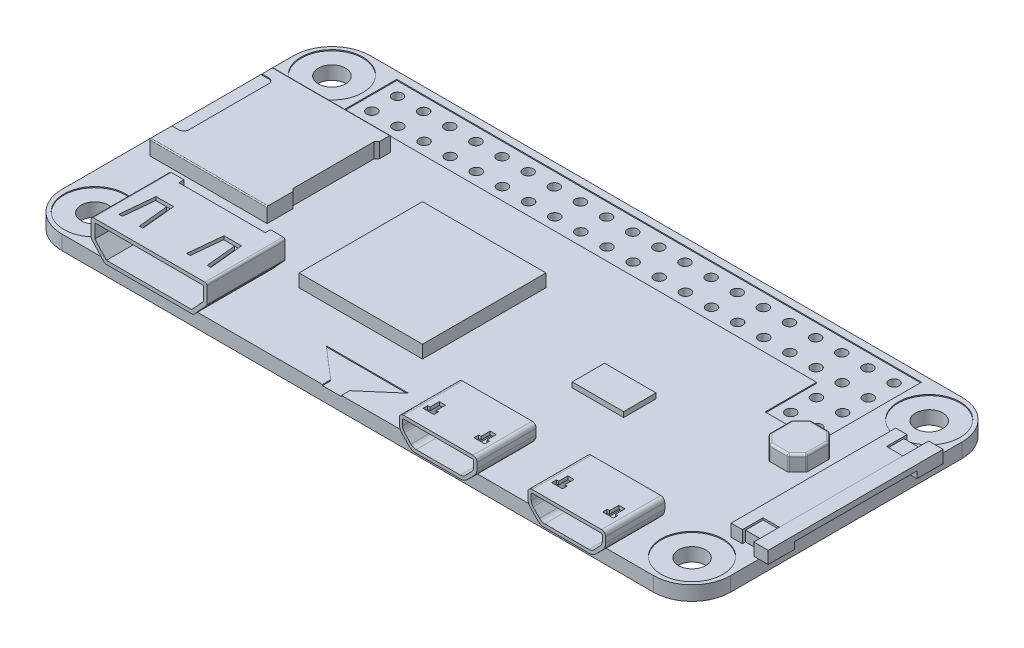
from build123d import *

# Parameters (mm, degrees)
BOSS_EXTRUDE1_DEPTH      = 1.4
SKETCH2_R                = 1.325
CUT_EXTRUDE1_DEPTH       = 36.821920663
SKETCH3_R                = 0.5
CUT_EXTRUDE2_DEPTH       = 36.821920663
LPATTERN1_COUNT          = 20
LPATTERN1_PITCH          = 2.54
SKETCH5_R                = 0.5
CUT_EXTRUDE4_DEPTH       = 36.821920663
SKETCH4_R                = 3
CUT_EXTRUDE3_DEPTH       = 0.1
SKETCH6_W                = 12
SKETCH6_H                = 12
BOSS_EXTRUDE2_DEPTH      = 1.25
BOSS_EXTRUDE3_DEPTH      = 1.45
FILLET2_R                = 0.1
CUT_EXTRUDE5_DEPTH       = 65.240816464
CUT_EXTRUDE5_DEPTH_BACK  = 9.5
SKETCH8_W                = 11.8
SKETCH8_H                = 1.25
BOSS_EXTRUDE4_DEPTH      = 0.4
BOSS_EXTRUDE4_DEPTH_BACK = 7.2
FILLET1_R                = 0.2
CUT_EXTRUDE6_DEPTH       = 7
SKETCH11_W               = 7
SKETCH11_H               = 0.55
BOSS_EXTRUDE5_DEPTH      = 3.5
CUT_EXTRUDE7_DEPTH       = 37.226130072
SKETCH13_W               = 8.4
SKETCH13_H               = 1.4
CUT_EXTRUDE8_DEPTH       = 0.5
BOSS_EXTRUDE6_DEPTH      = 1.25
BOSS_EXTRUDE6_DEPTH_BACK = 4.5
CUT_EXTRUDE9_DEPTH       = 5.25
SKETCH17_W               = 3.15
SKETCH17_H               = 0.4
BOSS_EXTRUDE7_DEPTH      = 3.5
CUT_EXTRUDE10_DEPTH      = 0.32
BOSS_EXTRUDE8_DEPTH      = 0.9
BOSS_EXTRUDE8_DEPTH_BACK = 0.5
BOSS_EXTRUDE9_DEPTH      = 1.19
SKETCH21_W               = 1.6
SKETCH21_H               = 1.7
BOSS_EXTRUDE10_DEPTH     = 1
SKETCH22_W               = 3.65
SKETCH22_H               = 4
BOSS_EXTRUDE11_DEPTH     = 1.5
CHAMFER1_SIZE            = 0.9
SKETCH23_W               = 5
SKETCH23_H               = 3.15
BOSS_EXTRUDE12_DEPTH     = 0.5
FILLET3_R                = 0.2
SKETCH_1_R               = 0.75
SKETCH_1_R_2             = 0.6
EXTRUDE_1_DEPTH          = 0.1


with BuildPart() as part:
    # Sketch1 → Boss-Extrude1 (new body)
    with BuildSketch(Plane(origin=(0, 0, 0), x_dir=(1, 0, 0), z_dir=(0, 1, 0))):
        with BuildLine():
            Line((-28.75, 15), (28.75, 15))
            ThreePointArc((28.75, 15), (31.401650429, 13.901650429), (32.5, 11.25))
            Line((32.5, 11.25), (32.5, -11.25))
            ThreePointArc((32.5, -11.25), (31.401650429, -13.901650429), (28.75, -15))
            Line((28.75, -15), (-28.75, -15))
            ThreePointArc((-28.75, -15), (-31.401650429, -13.901650429), (-32.5, -11.25))
            Line((-32.5, -11.25), (-32.5, 11.25))
            ThreePointArc((-32.5, 11.25), (-31.401650429, 13.901650429), (-28.75, 15))
        make_face()
    extrude(amount=BOSS_EXTRUDE1_DEPTH)

    # Sketch2 → Cut-Extrude1 (cut, through all)
    with BuildSketch(Plane(origin=(0, 1.4, 0), x_dir=(1, 0, 0), z_dir=(0, 1, 0))):
        with Locations(Location((-29.025, 11.525, 0), (0, 0, 270))):
            Circle(SKETCH2_R)
        with Locations(Location((29.025, 11.525, 0), (0, 0, 90))):
            Circle(SKETCH2_R)
        with Locations(Location((29.025, -11.525, 0), (0, 0, 270))):
            Circle(SKETCH2_R)
        with Locations(Location((-29.025, -11.525, 0), (0, 0, 90))):
            Circle(SKETCH2_R)
    extrude(amount=-CUT_EXTRUDE1_DEPTH, mode=Mode.SUBTRACT)

    # Sketch3 → Cut-Extrude2 (cut, through all)
    with BuildSketch(Plane(origin=(0, 1.4, 0), x_dir=(1, 0, 0), z_dir=(0, 1, 0))):
        with Locations(Location((-24.128, 13, 0), (0, 0, 270))):
            Circle(SKETCH3_R)
        with Locations(Location((-24.128, 10.5, 0), (0, 0, 270))):
            Circle(SKETCH3_R)
    cut_extrude2 = extrude(amount=-CUT_EXTRUDE2_DEPTH, mode=Mode.SUBTRACT)

    # LPattern1: Cut-Extrude2 ×20
    with Locations(*[(i * LPATTERN1_PITCH, 0, 0) for i in range(1, LPATTERN1_COUNT)]):
        add(cut_extrude2, mode=Mode.SUBTRACT)

    # Sketch5 → Cut-Extrude4 (cut, through all)
    with BuildSketch(Plane(origin=(0, 1.4, 0), x_dir=(1, 0, 0), z_dir=(0, 1, 0))):
        with Locations(Location((21.592, 5.5, 0), (0, 0, 270))):
            Circle(SKETCH5_R)
        with Locations(Location((24.132, 5.5, 0), (0, 0, 270))):
            Circle(SKETCH5_R)
        with Locations(Location((21.592, 8, 0), (0, 0, 270))):
            Circle(SKETCH5_R)
        with Locations(Location((24.132, 8, 0), (0, 0, 270))):
            Circle(SKETCH5_R)
    extrude(amount=-CUT_EXTRUDE4_DEPTH, mode=Mode.SUBTRACT)

    # Sketch4 → Cut-Extrude3 (cut)
    with BuildSketch(Plane(origin=(0, 1.4, 0), x_dir=(1, 0, 0), z_dir=(0, 1, 0))):
        with Locations(Location((-29.025, 11.525, 0), (0, 0, 270))):
            Circle(SKETCH4_R)
        with Locations(Location((-29.025, -11.525, 0), (0, 0, 270))):
            Circle(SKETCH4_R)
        with Locations(Location((29.025, -11.525, 0), (0, 0, 270))):
            Circle(SKETCH4_R)
        with Locations(Location((29.025, 11.525, 0), (0, 0, 270))):
            Circle(SKETCH4_R)
        Polygon((-25.5, 14.3), (25.5, 14.3), (25.5, 9.2), (25.5, 4.2), (20.4, 4.2), (20.4, 9.2), (-25.5, 9.2), align=None)
        Polygon((-6.5, -11.55), (1.5, -11.55), (-1.575, -14.2), (-1.575, -15), (-3.425, -15), (-3.425, -14.2), align=None)
    extrude(amount=-CUT_EXTRUDE3_DEPTH, mode=Mode.SUBTRACT)

    # Sketch6 → Boss-Extrude2 (add)
    with BuildSketch(Plane(origin=(0, 1.4, 0), x_dir=(1, 0, 0), z_dir=(0, 1, 0))):
        with Locations((-6.7, -2)):
            Rectangle(SKETCH6_W, SKETCH6_H)
    extrude(amount=BOSS_EXTRUDE2_DEPTH)

    # Sketch7 → Boss-Extrude3 (add)
    with BuildSketch(Plane(origin=(0, 1.4, 0), x_dir=(1, 0, 0), z_dir=(0, 1, 0))):
        with BuildLine():
            Line((-19.65, 7.85), (-19.65, 6.75))
            Line((-19.65, 6.75), (-19.9, 6.5))
            Line((-19.9, 6.5), (-19.9, -1.4))
            Line((-19.9, -1.4), (-19.65, -1.65))
            Line((-19.65, -1.65), (-19.65, -4.15))
            Line((-19.65, -4.15), (-31.05, -4.15))
            Line((-31.05, -4.15), (-31.05, -2))
            Line((-31.05, -2), (-30.4, -2))
            ThreePointArc((-30.4, -2), (-30.046446609, -1.853553391), (-29.9, -1.5))
            Line((-29.9, -1.5), (-29.9, 6.25))
            ThreePointArc((-29.9, 6.25), (-30.046446609, 6.603553391), (-30.4, 6.75))
            Line((-30.4, 6.75), (-31.05, 6.75))
            Line((-31.05, 6.75), (-31.05, 7.85))
            Line((-31.05, 7.85), (-19.65, 7.85))
        make_face()
    extrude(amount=BOSS_EXTRUDE3_DEPTH)

    # Fillet2
    fillet2_edges = [part.edges().sort_by_distance(p)[0] for p in [
        (-25.35, 2.85, 4.15),
        (-25.35, 2.85, -7.85),
    ]]
    fillet(fillet2_edges, radius=FILLET2_R)

    # Sketch8 → Cut-Extrude5 (cut, two sides: drawn at the far end of the back side and taken through both)
    with BuildSketch(Plane.ZY.offset(29.9).offset(-CUT_EXTRUDE5_DEPTH_BACK)):
        with Locations((-1.85, 2.125)):
            Rectangle(SKETCH8_W, SKETCH8_H)
    extrude(amount=CUT_EXTRUDE5_DEPTH + CUT_EXTRUDE5_DEPTH_BACK, mode=Mode.SUBTRACT)

    # Sketch15 → Boss-Extrude6 (add, two sides: drawn at the far end of the back side and taken through both)
    with BuildSketch(Plane.XY.offset(15).offset(-BOSS_EXTRUDE6_DEPTH_BACK)):
        with BuildLine():
            Line((18.2, 4), (24.95, 4))
            ThreePointArc((24.95, 4), (25.232842712, 3.882842712), (25.35, 3.6))
            Line((25.35, 3.6), (25.35, 3.052310288))
            ThreePointArc((25.35, 3.052310288), (25.277735771, 2.679072643), (25.071387321, 2.359778459))
            Line((25.071387321, 2.359778459), (24.445169445, 1.707468172))
            ThreePointArc((24.445169445, 1.707468172), (24.115871509, 1.480072876), (23.723782124, 1.4))
            Line((23.723782124, 1.4), (19.426217876, 1.4))
            ThreePointArc((19.426217876, 1.4), (19.034128491, 1.480072876), (18.704830555, 1.707468172))
            Line((18.704830555, 1.707468172), (18.078612679, 2.359778459))
            ThreePointArc((18.078612679, 2.359778459), (17.872264229, 2.679072643), (17.8, 3.052310288))
            Line((17.8, 3.052310288), (17.8, 3.6))
            ThreePointArc((17.8, 3.6), (17.917157288, 3.882842712), (18.2, 4))
        make_face()
        with BuildLine():
            Line((12.85, 3.6), (12.85, 3.052310288))
            ThreePointArc((12.85, 3.052310288), (12.777735771, 2.679072643), (12.571387321, 2.359778459))
            Line((12.571387321, 2.359778459), (11.945169445, 1.707468172))
            ThreePointArc((11.945169445, 1.707468172), (11.615871509, 1.480072876), (11.223782124, 1.4))
            Line((11.223782124, 1.4), (6.926217876, 1.4))
            ThreePointArc((6.926217876, 1.4), (6.534128491, 1.480072876), (6.204830555, 1.707468172))
            Line((6.204830555, 1.707468172), (5.578612679, 2.359778459))
            ThreePointArc((5.578612679, 2.359778459), (5.372264229, 2.679072643), (5.3, 3.052310288))
            Line((5.3, 3.052310288), (5.3, 3.6))
            ThreePointArc((5.3, 3.6), (5.417157288, 3.882842712), (5.7, 4))
            Line((5.7, 4), (12.45, 4))
            ThreePointArc((12.45, 4), (12.732842712, 3.882842712), (12.85, 3.6))
        make_face()
    extrude(amount=BOSS_EXTRUDE6_DEPTH + BOSS_EXTRUDE6_DEPTH_BACK)

    # Sketch16 → Cut-Extrude9 (cut)
    with BuildSketch(Plane.XY.offset(16.25)):
        with BuildLine():
            Line((12.45, 3.68), (5.7, 3.68))
            ThreePointArc((5.7, 3.68), (5.643431458, 3.656568542), (5.62, 3.6))
            Line((5.62, 3.6), (5.62, 3.052310288))
            ThreePointArc((5.62, 3.052310288), (5.669139676, 2.798508689), (5.809456622, 2.581388644))
            Line((5.809456622, 2.581388644), (6.435674498, 1.929078357))
            ThreePointArc((6.435674498, 1.929078357), (6.659597094, 1.774449555), (6.926217876, 1.72))
            Line((6.926217876, 1.72), (11.223782124, 1.72))
            ThreePointArc((11.223782124, 1.72), (11.490402906, 1.774449555), (11.714325502, 1.929078357))
            Line((11.714325502, 1.929078357), (12.340543378, 2.581388644))
            ThreePointArc((12.340543378, 2.581388644), (12.480860324, 2.798508689), (12.53, 3.052310288))
            Line((12.53, 3.052310288), (12.53, 3.6))
            ThreePointArc((12.53, 3.6), (12.506568542, 3.656568542), (12.45, 3.68))
        make_face()
        with BuildLine():
            Line((24.214325502, 1.929078357), (24.840543378, 2.581388644))
            ThreePointArc((24.840543378, 2.581388644), (24.980860324, 2.798508689), (25.03, 3.052310288))
            Line((25.03, 3.052310288), (25.03, 3.6))
            ThreePointArc((25.03, 3.6), (25.006568542, 3.656568542), (24.95, 3.68))
            Line((24.95, 3.68), (18.2, 3.68))
            ThreePointArc((18.2, 3.68), (18.143431458, 3.656568542), (18.12, 3.6))
            Line((18.12, 3.6), (18.12, 3.052310288))
            ThreePointArc((18.12, 3.052310288), (18.169139676, 2.798508689), (18.309456622, 2.581388644))
            Line((18.309456622, 2.581388644), (18.935674498, 1.929078357))
            ThreePointArc((18.935674498, 1.929078357), (19.159597094, 1.774449555), (19.426217876, 1.72))
            Line((19.426217876, 1.72), (23.723782124, 1.72))
            ThreePointArc((23.723782124, 1.72), (23.990402906, 1.774449555), (24.214325502, 1.929078357))
        make_face()
    extrude(amount=-CUT_EXTRUDE9_DEPTH, mode=Mode.SUBTRACT)

    # Sketch17 → Boss-Extrude7 (add)
    with BuildSketch(Plane.XY.offset(11)):
        with Locations((9.075, 3.12)):
            Rectangle(SKETCH17_W, SKETCH17_H)
        with Locations((21.575, 3.12)):
            Rectangle(SKETCH17_W, SKETCH17_H)
    extrude(amount=BOSS_EXTRUDE7_DEPTH)

    # Sketch18 → Cut-Extrude10 (cut)
    with BuildSketch(Plane(origin=(0, 4, 0), x_dir=(1, 0, 0), z_dir=(0, 1, 0))):
        Polygon((6.9, -13.37), (6.3, -13.37), (6.3, -14.27), (6.075, -14.27), (6.075, -14.72), (7.125, -14.72), (7.125, -14.27), (6.9, -14.27), align=None)
        Polygon((11.25, -13.37), (11.25, -14.27), (11.025, -14.27), (11.025, -14.72), (12.075, -14.72), (12.075, -14.27), (11.85, -14.27), (11.85, -13.37), align=None)
        Polygon((19.4, -13.37), (18.8, -13.37), (18.8, -14.27), (18.575, -14.27), (18.575, -14.72), (19.625, -14.72), (19.625, -14.27), (19.4, -14.27), align=None)
        Polygon((23.75, -13.37), (23.75, -14.27), (23.525, -14.27), (23.525, -14.72), (24.575, -14.72), (24.575, -14.27), (24.35, -14.27), (24.35, -13.37), align=None)
    extrude(amount=-CUT_EXTRUDE10_DEPTH, mode=Mode.SUBTRACT)

    # Sketch19 → Boss-Extrude8 (add, two sides: drawn at the far end of the back side and taken through both)
    with BuildSketch(Plane(origin=(32.5, 0, 0), x_dir=(0, 0, -1), z_dir=(1, 0, 0)).offset(-BOSS_EXTRUDE8_DEPTH_BACK)):
        Polygon((-8.5, 2.6), (8.5, 2.6), (8.5, 1.4), (5.95, 1.4), (5.95, 2.05), (-5.95, 2.05), (-5.95, 1.4), (-8.5, 1.4), align=None)
    extrude(amount=BOSS_EXTRUDE8_DEPTH + BOSS_EXTRUDE8_DEPTH_BACK)

    # Sketch20 → Boss-Extrude9 (add)
    with BuildSketch(Plane(origin=(0, 1.4, 0), x_dir=(1, 0, 0), z_dir=(0, 1, 0))):
        Polygon((32, 6), (30.4, 6), (30.4, 8), (29.3, 8), (29.3, -8), (30.4, -8), (30.4, -6), (32, -6), align=None)
    extrude(amount=BOSS_EXTRUDE9_DEPTH)

    # Sketch21 → Boss-Extrude10 (add)
    with BuildSketch(Plane(origin=(0, 1.4, 0), x_dir=(1, 0, 0), z_dir=(0, 1, 0))):
        with Locations((31.2, 6.85)):
            Rectangle(SKETCH21_W, SKETCH21_H)
        with Locations((31.2, -6.85)):
            Rectangle(SKETCH21_W, SKETCH21_H)
    extrude(amount=BOSS_EXTRUDE10_DEPTH)

    # Sketch22 → Boss-Extrude11 (add)
    with BuildSketch(Plane(origin=(0, 1.4, 0), x_dir=(1, 0, 0), z_dir=(0, 1, 0))):
        with Locations((25.675, 2.25)):
            Rectangle(SKETCH22_W, SKETCH22_H)
    extrude(amount=BOSS_EXTRUDE11_DEPTH)

    # Chamfer1
    # the kernel refuses this chamfer: 0.9 mm, written as the material it takes off along each edge
    with BuildSketch(Plane(origin=(23.85, 1.4, -4.25), x_dir=(0.9996219169112966, 0, -0.027495876610586487), z_dir=(0, 1, 0))) as chamfer1_piece_1:
        Polygon((CHAMFER1_SIZE * 0.999621916911, -CHAMFER1_SIZE * 0.0274958766106), (-CHAMFER1_SIZE * 0.0274958766106, -CHAMFER1_SIZE * 0.999621916911), (0, 0), align=None)
    extrude(amount=3.814514689, mode=Mode.SUBTRACT)
    with BuildSketch(Plane(origin=(23.85, 1.4, -0.25), x_dir=(0.9996219169112966, 0, 0.027495876610586487), z_dir=(0, 1, 0)), Plane(origin=(27.5, 1.4, -0.25), x_dir=(0.027495876610584467, 0, -0.9996219169112966), z_dir=(0, 1, 0)), Plane(origin=(27.5, 1.4, -4.25), x_dir=(-0.9996219169112966, 0, -0.027495876610586487), z_dir=(0, 1, 0))) as chamfer1_piece_2:
        Polygon((CHAMFER1_SIZE * 0.999621916911, CHAMFER1_SIZE * 0.0274958766106), (-CHAMFER1_SIZE * 0.0274958766106, CHAMFER1_SIZE * 0.999621916911), (0, 0), align=None)
    extrude(amount=3.814514689, mode=Mode.SUBTRACT)

    # Sketch23 → Boss-Extrude12 (add)
    with BuildSketch(Plane(origin=(0, 1.4, 0), x_dir=(1, 0, 0), z_dir=(0, 1, 0))):
        with Locations((11.5, -1.575)):
            Rectangle(SKETCH23_W, SKETCH23_H)
    extrude(amount=BOSS_EXTRUDE12_DEPTH)

    # Fillet3
    # the kernel refuses this fillet: 0.2 mm, written as the material it takes off along each edge
    with BuildSketch(Plane(origin=(24.05, 2.7, -1.232842712), x_dir=(-1, 0, 0), z_dir=(0, 1, 0))) as fillet3_piece_1_section:
        Polygon((0, 0), (FILLET3_R, 0), (FILLET3_R, FILLET3_R * 0.414213562373), (FILLET3_R * 0.707106781187, FILLET3_R * 0.707106781186), align=None)
    fillet3_piece_1 = extrude(amount=FILLET3_R, mode=Mode.PRIVATE)
    fillet3_piece_1 = fillet3_piece_1 - Plane(origin=(24.05, 2.7, -1.232842712), x_dir=(0.9238795325113632, 0, -0.38268343236490504), z_dir=(0, 1, 0)) * Sphere(FILLET3_R, mode=Mode.PRIVATE)
    add(fillet3_piece_1, mode=Mode.SUBTRACT)
    with BuildSketch(Plane(origin=(24.05, 2.7, -3.267157288), x_dir=(-0.7071067811868302, 0, -0.7071067811862648), z_dir=(0, 1, 0))) as fillet3_piece_2_section:
        Polygon((0, 0), (FILLET3_R, 0), (FILLET3_R, FILLET3_R * 0.414213562373), (FILLET3_R * 0.707106781187, FILLET3_R * 0.707106781186), align=None)
    fillet3_piece_2 = extrude(amount=FILLET3_R, mode=Mode.PRIVATE)
    fillet3_piece_2 = fillet3_piece_2 - Plane(origin=(24.05, 2.7, -3.267157288), x_dir=(0.9238795325113632, 0, 0.38268343236490504), z_dir=(0, 1, 0)) * Sphere(FILLET3_R, mode=Mode.PRIVATE)
    add(fillet3_piece_2, mode=Mode.SUBTRACT)
    with BuildSketch(Plane(origin=(24.832842712, 2.7, -4.05), x_dir=(0, 0, -1), z_dir=(0, 1, 0))) as fillet3_piece_3_section:
        Polygon((0, 0), (FILLET3_R, 0), (FILLET3_R, FILLET3_R * 0.414213562373), (FILLET3_R * 0.707106781186, FILLET3_R * 0.707106781187), align=None)
    fillet3_piece_3 = extrude(amount=FILLET3_R, mode=Mode.PRIVATE)
    fillet3_piece_3 = fillet3_piece_3 - Plane(origin=(24.832842712, 2.7, -4.05), x_dir=(0.38268343236527447, 0, 0.9238795325112102), z_dir=(0, 1, 0)) * Sphere(FILLET3_R, mode=Mode.PRIVATE)
    add(fillet3_piece_3, mode=Mode.SUBTRACT)
    with BuildSketch(Plane(origin=(26.517157288, 2.7, -4.05), x_dir=(0, 0, -1), z_dir=(0, 1, 0))) as fillet3_piece_4_section:
        Polygon((0, 0), (FILLET3_R, 0), (FILLET3_R, -FILLET3_R * 0.414213562373), (FILLET3_R * 0.707106781186, -FILLET3_R * 0.707106781187), align=None)
    fillet3_piece_4 = extrude(amount=FILLET3_R, mode=Mode.PRIVATE)
    fillet3_piece_4 = fillet3_piece_4 - Plane(origin=(26.517157288, 2.7, -4.05), x_dir=(-0.38268343236527447, 0, 0.9238795325112102), z_dir=(0, 1, 0)) * Sphere(FILLET3_R, mode=Mode.PRIVATE)
    add(fillet3_piece_4, mode=Mode.SUBTRACT)
    with BuildSketch(Plane(origin=(26.517157288, 2.7, -0.45), x_dir=(0, 0, 1), z_dir=(0, 1, 0))) as fillet3_piece_5_section:
        Polygon((0, 0), (FILLET3_R, 0), (FILLET3_R, FILLET3_R * 0.414213562373), (FILLET3_R * 0.707106781187, FILLET3_R * 0.707106781186), align=None)
    fillet3_piece_5 = extrude(amount=FILLET3_R, mode=Mode.PRIVATE)
    fillet3_piece_5 = fillet3_piece_5 - Plane(origin=(26.517157288, 2.7, -0.45), x_dir=(-0.3826834323649051, 0, -0.9238795325113633), z_dir=(0, 1, 0)) * Sphere(FILLET3_R, mode=Mode.PRIVATE)
    add(fillet3_piece_5, mode=Mode.SUBTRACT)
    with BuildSketch(Plane(origin=(24.832842712, 2.7, -0.45), x_dir=(0, 0, 1), z_dir=(0, 1, 0))) as fillet3_piece_6_section:
        Polygon((0, 0), (FILLET3_R, 0), (FILLET3_R, -FILLET3_R * 0.414213562373), (FILLET3_R * 0.707106781186, -FILLET3_R * 0.707106781187), align=None)
    fillet3_piece_6 = extrude(amount=FILLET3_R, mode=Mode.PRIVATE)
    fillet3_piece_6 = fillet3_piece_6 - Plane(origin=(24.832842712, 2.7, -0.45), x_dir=(0.38268343236527447, 0, -0.9238795325112102), z_dir=(0, 1, 0)) * Sphere(FILLET3_R, mode=Mode.PRIVATE)
    add(fillet3_piece_6, mode=Mode.SUBTRACT)
    with BuildSketch(Plane(origin=(27.3, 2.7, -3.267157288), x_dir=(0.7071067811868302, 0, -0.7071067811862648), z_dir=(0, 1, 0))) as fillet3_piece_7_section:
        Polygon((0, 0), (FILLET3_R, 0), (FILLET3_R, -FILLET3_R * 0.414213562373), (FILLET3_R * 0.707106781187, -FILLET3_R * 0.707106781186), align=None)
    fillet3_piece_7 = extrude(amount=FILLET3_R, mode=Mode.PRIVATE)
    fillet3_piece_7 = fillet3_piece_7 - Plane(origin=(27.3, 2.7, -3.267157288), x_dir=(-0.9238795325113632, 0, 0.38268343236490504), z_dir=(0, 1, 0)) * Sphere(FILLET3_R, mode=Mode.PRIVATE)
    add(fillet3_piece_7, mode=Mode.SUBTRACT)
    with BuildSketch(Plane(origin=(27.3, 2.7, -1.232842712), x_dir=(1, 0, 0), z_dir=(0, 1, 0))) as fillet3_piece_8_section:
        Polygon((0, 0), (FILLET3_R, 0), (FILLET3_R, -FILLET3_R * 0.414213562373), (FILLET3_R * 0.707106781186, -FILLET3_R * 0.707106781187), align=None)
    fillet3_piece_8 = extrude(amount=FILLET3_R, mode=Mode.PRIVATE)
    fillet3_piece_8 = fillet3_piece_8 - Plane(origin=(27.3, 2.7, -1.232842712), x_dir=(-0.9238795325112102, 0, -0.38268343236527447), z_dir=(0, 1, 0)) * Sphere(FILLET3_R, mode=Mode.PRIVATE)
    add(fillet3_piece_8, mode=Mode.SUBTRACT)
    with BuildSketch(Plane(origin=(23.85, 2.9, -1.232842712), x_dir=(0, -1, 0), z_dir=(0, 0, -1)), Plane(origin=(27.5, 2.9, -3.267157288), x_dir=(0, -1, 0), z_dir=(0, 0, 1))) as fillet3_piece_9:
        with BuildLine():
            CenterArc((FILLET3_R, -FILLET3_R), FILLET3_R, 90, 90)
            Line((0, -FILLET3_R), (0, 0))
            Line((0, 0), (FILLET3_R, 0))
        make_face()
    extrude(amount=2.034314575, mode=Mode.SUBTRACT)
    with BuildSketch(Plane(origin=(23.85, 1.4, -1.15), x_dir=(-4.331389821029687e-12, 0, -1.0), z_dir=(0, 1, 0)), Plane(origin=(23.85, 1.4, -3.35), x_dir=(0.7071067811862634, 0, -0.7071067811868317), z_dir=(0, 1, 0)), Plane(origin=(24.75, 1.4, -4.25), x_dir=(1.0, 0, 4.299226035225122e-12), z_dir=(0, 1, 0))) as fillet3_piece_10:
        with BuildLine():
            CenterArc((FILLET3_R * 0.414213562369, -FILLET3_R), FILLET3_R, 90, 45)
            Line((-FILLET3_R * 0.292893218816, -FILLET3_R * 0.292893218811), (0, 0))
            Line((0, 0), (FILLET3_R * 0.414213562373, 0))
        make_face()
    extrude(amount=1.3, mode=Mode.SUBTRACT)
    with BuildSketch(Plane(origin=(24.832842712, 2.9, -4.25), x_dir=(0, -1, 0), z_dir=(1, 0, 0)), Plane(origin=(26.517157288, 2.9, -0.25), x_dir=(0, -1, 0), z_dir=(-1, 0, 0))) as fillet3_piece_11:
        with BuildLine():
            CenterArc((FILLET3_R, -FILLET3_R), FILLET3_R, 90, 90)
            Line((0, -FILLET3_R), (0, 0))
            Line((0, 0), (FILLET3_R, 0))
        make_face()
    extrude(amount=1.684314575, mode=Mode.SUBTRACT)
    with BuildSketch(Plane(origin=(26.6, 1.4, -4.25), x_dir=(-1.0, 0, 4.299226035225122e-12), z_dir=(0, 1, 0)), Plane(origin=(27.5, 1.4, -1.15), x_dir=(-4.331389821024788e-12, 0, -1.0), z_dir=(0, 1, 0)), Plane(origin=(27.5, 1.4, -3.35), x_dir=(-0.7071067811862634, 0, -0.7071067811868317), z_dir=(0, 1, 0)), Plane(origin=(24.75, 1.4, -0.25), x_dir=(1.0, 0, -4.38801148560968e-12), z_dir=(0, 1, 0)), Plane(origin=(26.6, 1.4, -0.25), x_dir=(0.7071067811868266, 0, -0.7071067811862685), z_dir=(0, 1, 0))) as fillet3_piece_12:
        with BuildLine():
            CenterArc((FILLET3_R * 0.414213562378, FILLET3_R), FILLET3_R, 225, 45)
            Line((-FILLET3_R * 0.292893218811, FILLET3_R * 0.292893218816), (0, 0))
            Line((0, 0), (FILLET3_R * 0.414213562373, 0))
        make_face()
    extrude(amount=1.3, mode=Mode.SUBTRACT)
    with BuildSketch(Plane(origin=(24.691421356, 2.9, -0.308578644), x_dir=(0, -1, 0), z_dir=(-0.7071067811862648, 0, -0.7071067811868302)), Plane(origin=(27.441421356, 2.9, -1.091421356), x_dir=(0, -1, 0), z_dir=(-0.7071067811868302, 0, 0.7071067811862648)), Plane(origin=(26.658578644, 2.9, -4.191421356), x_dir=(0, -1, 0), z_dir=(0.7071067811862648, 0, 0.7071067811868302))) as fillet3_piece_13:
        with BuildLine():
            CenterArc((FILLET3_R, -FILLET3_R), FILLET3_R, 90, 90)
            Line((0, -FILLET3_R), (0, 0))
            Line((0, 0), (FILLET3_R, 0))
        make_face()
    extrude(amount=1.107106781, mode=Mode.SUBTRACT)
    with BuildSketch(Plane(origin=(24.691421356, 2.9, -4.191421356), x_dir=(0, -1, 0), z_dir=(-0.7071067811862648, 0, 0.7071067811868302))) as fillet3_piece_14:
        with BuildLine():
            CenterArc((FILLET3_R, FILLET3_R), FILLET3_R, 180, 90)
            Line((0, FILLET3_R), (0, 0))
            Line((0, 0), (FILLET3_R, 0))
        make_face()
    extrude(amount=1.107106781, mode=Mode.SUBTRACT)

    # 草图1 → 凸台-拉伸1 (add)
    with BuildSketch(Plane.XZ):
        with Locations(Location((22.059044148, 8.883324517, 0), (0, 0, 90))):
            Circle(SKETCH_1_R)
        with Locations(Location((22.059044148, 11.173176165, 0), (0, 0, 90))):
            Circle(SKETCH_1_R)
        with Locations(Location((8.324578667, 12.898148812, 0), (0, 0, 90))):
            Circle(SKETCH_1_R_2)
        with Locations(Location((10.197519327, 12.898148812, 0), (0, 0, 90))):
            Circle(SKETCH_1_R_2)
    extrude(amount=EXTRUDE_1_DEPTH)


with BuildPart() as body_2:
    # Sketch9 → Boss-Extrude4 (new, two sides: drawn at the far end of the back side and taken through both)
    with BuildSketch(Plane.XY.offset(15).offset(-BOSS_EXTRUDE4_DEPTH_BACK)):
        Polygon((-25.5, 4.7), (-14.25, 4.7), (-14.25, 2.85), (-15.575, 1.4), (-24.175, 1.4), (-25.5, 2.85), align=None)
    extrude(amount=BOSS_EXTRUDE4_DEPTH + BOSS_EXTRUDE4_DEPTH_BACK)

    # Fillet1
    fillet1_edges = [body_2.edges().sort_by_distance(p)[0] for p in [
        (-25.5, 4.7, 11.6),
        (-14.25, 4.7, 11.6),
        (-14.25, 2.85, 11.6),
        (-15.575, 1.4, 11.6),
        (-24.175, 1.4, 11.6),
        (-25.5, 2.85, 11.6),
    ]]
    fillet(fillet1_edges, radius=FILLET1_R)

    # Sketch10 → Cut-Extrude6 (cut)
    with BuildSketch(Plane.XY.offset(15.4)):
        Polygon((-25.15, 4.35), (-25.15, 2.985829331), (-24.020707681, 1.75), (-15.729292319, 1.75), (-14.6, 2.985829331), (-14.6, 4.35), align=None)
    extrude(amount=-CUT_EXTRUDE6_DEPTH, mode=Mode.SUBTRACT)

    # Sketch11 → Boss-Extrude5 (add)
    with BuildSketch(Plane.XY.offset(8.4)):
        with Locations((-19.875, 3.225)):
            Rectangle(SKETCH11_W, SKETCH11_H)
    extrude(amount=BOSS_EXTRUDE5_DEPTH)

    # Sketch12 → Cut-Extrude7 (cut, through all)
    with BuildSketch(Plane.XZ.offset(-4.35)):
        Polygon((-24.025, 10.57), (-22.325, 10.57), (-22, 13.87), (-22.351693275, 13.87), (-22.642223578, 10.92), (-23.707776422, 10.92), (-23.998306725, 13.87), (-24.35, 13.87), align=None)
        Polygon((-15.725, 10.57), (-15.4, 13.87), (-15.751693275, 13.87), (-16.042223578, 10.92), (-17.107776422, 10.92), (-17.398306725, 13.87), (-17.75, 13.87), (-17.425, 10.57), align=None)
    extrude(amount=-CUT_EXTRUDE7_DEPTH, mode=Mode.SUBTRACT)

    # Sketch13 → Cut-Extrude8 (cut)
    with BuildSketch(Plane(origin=(0, 0, 7.8), x_dir=(-1, 0, 0), z_dir=(0, 0, -1))):
        with Locations((19.875, 4)):
            Rectangle(SKETCH13_W, SKETCH13_H)
    extrude(amount=-CUT_EXTRUDE8_DEPTH, mode=Mode.SUBTRACT)


solid = Compound([part.part, body_2.part])
